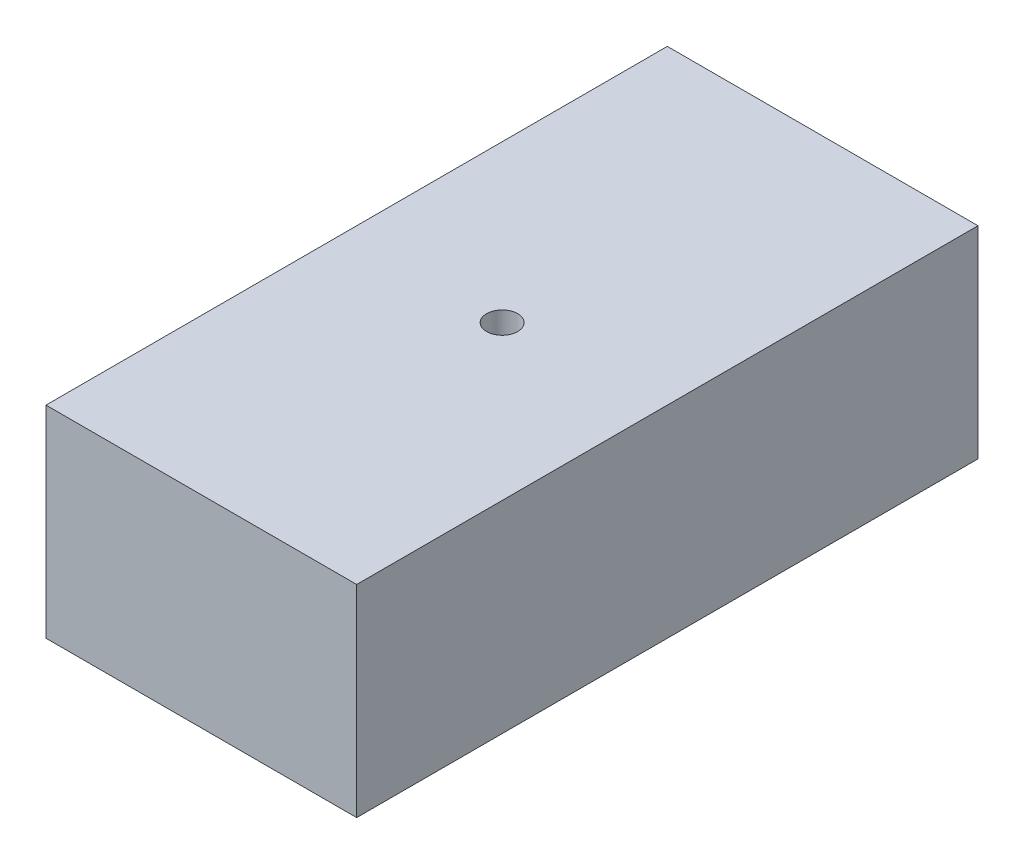
from build123d import *

# Parameters (mm, degrees)
SKETCH1_W                  = 100
SKETCH1_H                  = 200
BOSS_EXTRUDE1_DEPTH        = 65
F_10_0MM_DOWEL_HOLE1_D     = 10
F_10_0MM_DOWEL_HOLE1_DEPTH = 40
F_10_0MM_DOWEL_HOLE1_TIP   = 3.004303095


with BuildPart() as part:
    # Sketch1 → Boss-Extrude1 (new body)
    with BuildSketch(Plane(origin=(0, 0, 0), x_dir=(1, 0, 0), z_dir=(0, 1, 0))):
        with Locations((50, 100)):
            Rectangle(SKETCH1_W, SKETCH1_H)
    extrude(amount=BOSS_EXTRUDE1_DEPTH)

    # Ø10.0mm Dowel Hole1
    with Locations(Plane(origin=(0, 65, 0), x_dir=(1, 0, 0), z_dir=(0, 1, 0))):
        with Locations((50.41652115, 96.403372713)):
            Hole(F_10_0MM_DOWEL_HOLE1_D / 2, depth=F_10_0MM_DOWEL_HOLE1_DEPTH)
            with Locations((0, 0, -(F_10_0MM_DOWEL_HOLE1_DEPTH + F_10_0MM_DOWEL_HOLE1_TIP / 2))):  # 118° drill point
                Cone(0, F_10_0MM_DOWEL_HOLE1_D / 2, F_10_0MM_DOWEL_HOLE1_TIP, mode=Mode.SUBTRACT)


solid = part.part
